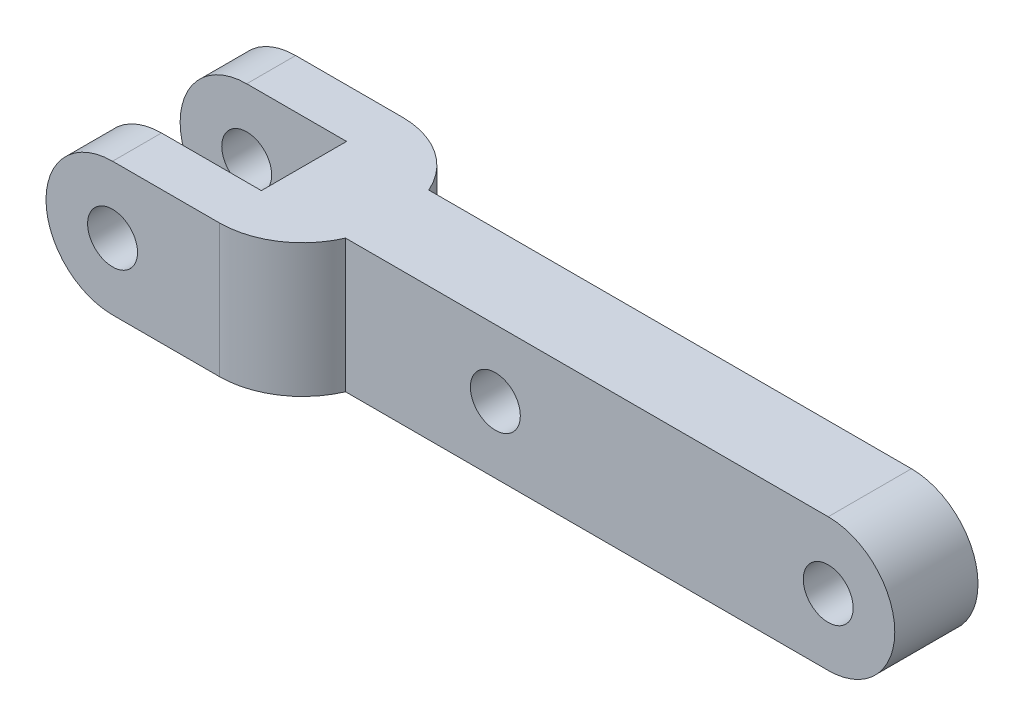
from build123d import *

# Parameters (mm, degrees)
SKETCH1_R                = 1.5
BOSS_EXTRUDE1_DEPTH      = 5
BOSS_EXTRUDE3_START      = -5
SKETCH3_R                = 1.5
BOSS_EXTRUDE3_DEPTH      = 5
BOSS_EXTRUDE5_DEPTH      = 6
BOSS_EXTRUDE5_DEPTH_BACK = 5
BOSS_EXTRUDE5_START      = -3
SKETCH5_R                = 1.5
SKETCH6_W                = 10
SKETCH6_H                = 5.12
CUT_EXTRUDE1_DEPTH       = 10
FILLET1_R                = 5


with BuildPart() as part:
    # Sketch1 → Boss-Extrude1 (new body)
    with BuildSketch(Plane.XY):
        with BuildLine():
            Line((-35.37698341, 4), (-15.37698341, 4))
            ThreePointArc((-15.37698341, 4), (-11.37698341, 0), (-15.37698341, -4))
            Line((-15.37698341, -4), (-35.37698341, -4))
            ThreePointArc((-35.37698341, -4), (-39.37698341, 0), (-35.37698341, 4))
        make_face()
        with Locations((-35.37698341, 0)):
            Circle(SKETCH1_R, mode=Mode.SUBTRACT)
        with Locations((-15.37698341, 0)):
            Circle(SKETCH1_R, mode=Mode.SUBTRACT)
    extrude(amount=BOSS_EXTRUDE1_DEPTH)

    # Sketch3 → Boss-Extrude3 (add)
    with BuildSketch(Plane.XY.offset(5).offset(BOSS_EXTRUDE3_START)):
        with BuildLine():
            Line((-55.37698341, -4), (-35.37698341, -4))
            ThreePointArc((-35.37698341, -4), (-39.37698341, 0), (-35.37698341, 4))
            Line((-35.37698341, 4), (-55.37698341, 4))
            ThreePointArc((-55.37698341, 4), (-59.37698341, 0), (-55.37698341, -4))
        make_face()
        with Locations((-55.37698341, 0)):
            Circle(SKETCH3_R, mode=Mode.SUBTRACT)
    extrude(amount=BOSS_EXTRUDE3_DEPTH)

    # Sketch5 → Boss-Extrude5 (add, two sides: drawn at the far end of the back side and taken through both)
    with BuildSketch(Plane.XY.offset(5).offset(BOSS_EXTRUDE5_START - BOSS_EXTRUDE5_DEPTH_BACK)):
        with BuildLine():
            Line((-44.37698341, -4), (-44.37698341, 4))
            Line((-44.37698341, 4), (-55.37698341, 4))
            ThreePointArc((-55.37698341, 4), (-59.37698341, 0), (-55.37698341, -4))
            Line((-55.37698341, -4), (-44.37698341, -4))
        make_face()
        with Locations((-55.37698341, 0)):
            Circle(SKETCH5_R, mode=Mode.SUBTRACT)
    extrude(amount=BOSS_EXTRUDE5_DEPTH + BOSS_EXTRUDE5_DEPTH_BACK)

    # Sketch6 → Cut-Extrude1 (cut)
    with BuildSketch(Plane(origin=(0, 4, 0), x_dir=(1, 0, 0), z_dir=(0, 1, 0))):
        with Locations((-54.37698341, -2.5)):
            Rectangle(SKETCH6_W, SKETCH6_H)
    extrude(amount=-CUT_EXTRUDE1_DEPTH, mode=Mode.SUBTRACT)

    # Fillet1
    # the kernel refuses this fillet: 5 mm, written as the material it takes off along each edge
    with BuildSketch(Plane(origin=(-44.37698341, -15.456439237, -3), x_dir=(0, 0, 1), z_dir=(0, 1, 0))) as fillet1_piece_1:
        with BuildLine():
            CenterArc((5, -4.582575695), FILLET1_R, 113.578178478, 66.421821522)
            Line((0, -4.582575695), (-0.1, -4.582575695))
            Line((-0.1, -4.582575695), (-0.1, 0))
            Line((-0.1, 0), (0, 0.1))
            ThreePointArc((0, 0.1), (1.5, 0.1), (2.96, 0.091651514))
            Line((2.96, 0.091651514), (3, 0))
        make_face()
    extrude(amount=30.912878475, mode=Mode.SUBTRACT)
    with BuildSketch(Plane(origin=(-44.37698341, -15.456439237, 8), x_dir=(-1, 0, 0), z_dir=(0, 1, 0))) as fillet1_piece_2:
        with BuildLine():
            CenterArc((4.582575695, -5), FILLET1_R, 90, 66.421821522)
            Line((0, -3), (-0.091651514, -2.96))
            ThreePointArc((-0.091651514, -2.96), (-0.1, -1.5), (-0.1, 0))
            Line((-0.1, 0), (0, 0.1))
            Line((0, 0.1), (4.582575695, 0.1))
            Line((4.582575695, 0.1), (4.582575695, 0))
        make_face()
    extrude(amount=30.912878475, mode=Mode.SUBTRACT)


solid = part.part
